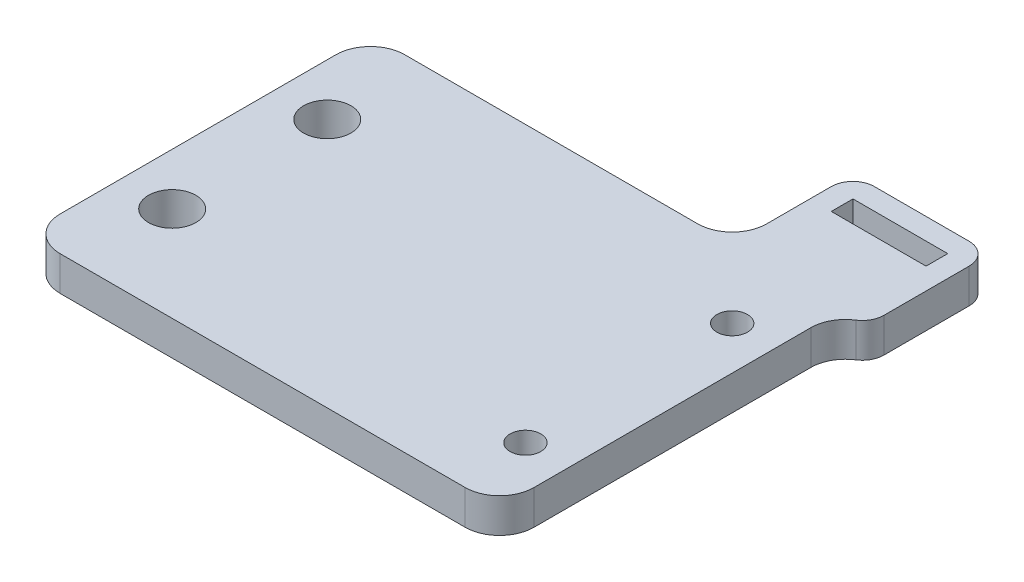
from build123d import *

# Parameters (mm, degrees)
SKETCH1_W               = 34.925
SKETCH1_H               = 25.4
BOSS_EXTRUDE1_DEPTH     = 2.54
CUT_EXTRUDE3_DEPTH      = 44.259302179
CUT_EXTRUDE3_DEPTH_BACK = 44.259302179
SKETCH2_R               = 1.74625
SKETCH5_R               = 1.1303
CUT_EXTRUDE4_DEPTH      = 44.259302179
SKETCH6_W               = 10.16
SKETCH6_H               = 8.89
BOSS_EXTRUDE2_DEPTH     = 2.54
SKETCH7_W               = 6.985
SKETCH7_H               = 1.6002
CUT_EXTRUDE5_DEPTH      = 51.385559439
FILLET1_R               = 2.54
FILLET2_R               = 1.5875
FILLET3_R               = 2.54


with BuildPart() as part:
    # Sketch1 → Boss-Extrude1 (new body)
    with BuildSketch(Plane(origin=(0, 0, 0), x_dir=(1, 0, 0), z_dir=(0, 1, 0))):
        with Locations((17.4625, 12.7)):
            Rectangle(SKETCH1_W, SKETCH1_H)
    extrude(amount=BOSS_EXTRUDE1_DEPTH)

    # Sketch2 → Cut-Extrude3 (cut, two sides: drawn at the far end of the back side and taken through both)
    with BuildSketch(Plane(origin=(0, 2.54, 0), x_dir=(1, 0, 0), z_dir=(0, 1, 0)).offset(-CUT_EXTRUDE3_DEPTH_BACK)):
        with Locations(Location((3.81, 18.415, 0), (0, 0, 90))):
            Circle(SKETCH2_R)
        with Locations(Location((3.81, 6.985, 0), (0, 0, 90))):
            Circle(SKETCH2_R)
    extrude(amount=CUT_EXTRUDE3_DEPTH + CUT_EXTRUDE3_DEPTH_BACK, mode=Mode.SUBTRACT)

    # Sketch5 → Cut-Extrude4 (cut, through all)
    with BuildSketch(Plane(origin=(0, 2.54, 0), x_dir=(1, 0, 0), z_dir=(0, 1, 0))):
        with Locations(Location((31.75, 20.32, 0), (0, 0, 270))):
            Circle(SKETCH5_R)
        with Locations(Location((31.75, 5.08, 0), (0, 0, 90))):
            Circle(SKETCH5_R)
    extrude(amount=-CUT_EXTRUDE4_DEPTH, mode=Mode.SUBTRACT)

    # Sketch6 → Boss-Extrude2 (add)
    with BuildSketch(Plane(origin=(0, 2.54, 0), x_dir=(1, 0, 0), z_dir=(0, 1, 0))):
        with Locations((31.75, 29.845)):
            Rectangle(SKETCH6_W, SKETCH6_H)
    extrude(amount=-BOSS_EXTRUDE2_DEPTH)

    # Sketch7 → Cut-Extrude5 (cut, through all)
    with BuildSketch(Plane(origin=(0, 2.54, 0), x_dir=(1, 0, 0), z_dir=(0, 1, 0))):
        with Locations((31.75, 31.913620935)):
            Rectangle(SKETCH7_W, SKETCH7_H)
    extrude(amount=-CUT_EXTRUDE5_DEPTH, mode=Mode.SUBTRACT)

    # Fillet1
    # the kernel refuses this fillet: 2.54 mm, written as the material it adds along each edge
    with BuildSketch(Plane(origin=(26.67, 2.54, -25.4), x_dir=(-1, 0, 0), z_dir=(0, -1, 0))) as fillet1_piece_1:
        with BuildLine():
            CenterArc((FILLET1_R, FILLET1_R), FILLET1_R, 180, 90)
            Line((0, FILLET1_R), (-FILLET1_R * 0.02, FILLET1_R))
            Line((-FILLET1_R * 0.02, FILLET1_R), (-FILLET1_R * 0.02, -FILLET1_R * 0.02))
            Line((-FILLET1_R * 0.02, -FILLET1_R * 0.02), (FILLET1_R, -FILLET1_R * 0.02))
            Line((FILLET1_R, -FILLET1_R * 0.02), (FILLET1_R, 0))
        make_face()
    extrude(amount=2.54)
    with BuildSketch(Plane(origin=(34.925, 0, -25.4), x_dir=(0, 0, 1), z_dir=(0, 1, 0))) as fillet1_piece_2:
        with BuildLine():
            CenterArc((2.459344425, 2.54), FILLET1_R, 194.477512186, 75.522487814)
            Line((0, 1.905), (-0.049186888, 1.8923))
            ThreePointArc((-0.049186888, 1.8923), (-0.0508, 0.9525), (-0.0508, 0))
            Line((-0.0508, 0), (0, -0.0508))
            Line((0, -0.0508), (2.459344425, -0.0508))
            Line((2.459344425, -0.0508), (2.459344425, 0))
        make_face()
    extrude(amount=2.54)

    # Fillet2
    fillet2_edges = [part.edges().sort_by_distance(p)[0] for p in [
        (26.67, 1.27, -34.29),
        (36.83, 1.27, -34.29),
        (36.83, 1.27, -25.4),
    ]]
    fillet(fillet2_edges, radius=FILLET2_R)

    # Fillet3
    fillet3_edges = [part.edges().sort_by_distance(p)[0] for p in [
        (0, 1.27, -25.4),
        (34.925, 1.27, 0),
        (0, 1.27, 0),
    ]]
    fillet(fillet3_edges, radius=FILLET3_R)


solid = part.part
